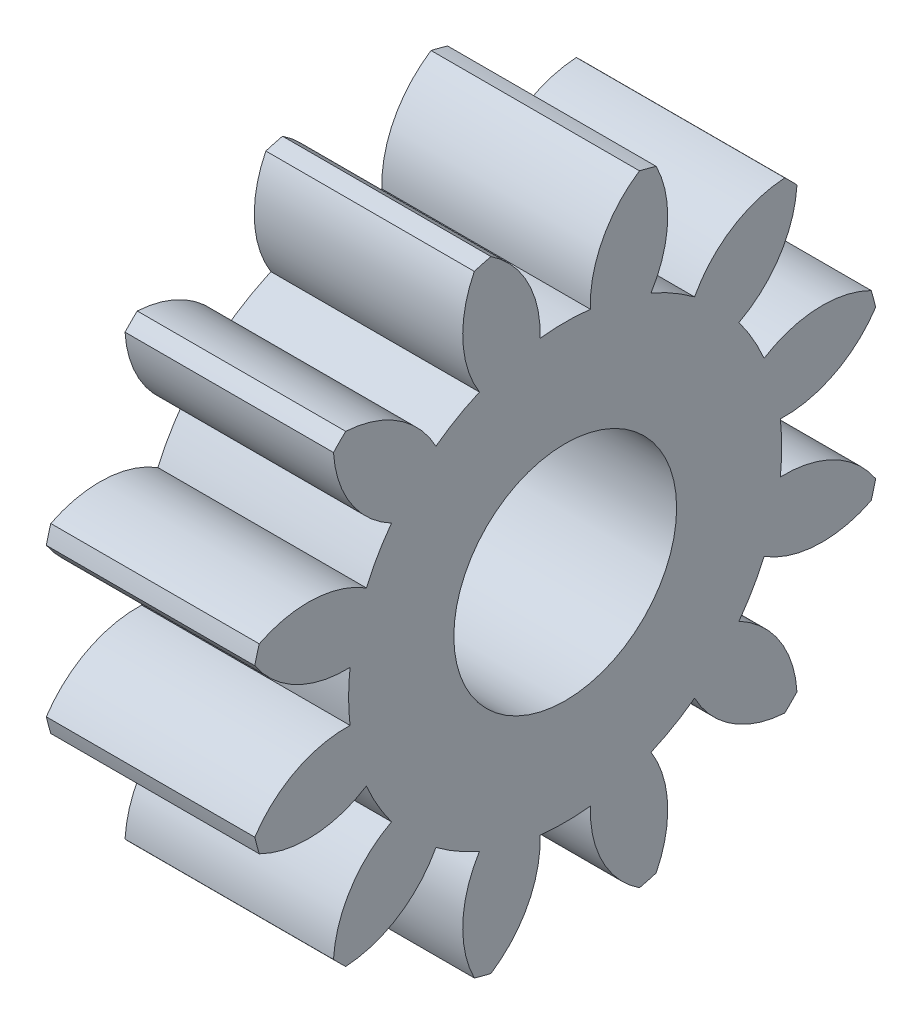
from build123d import *
from build123d.topology import SkipClean

# Parameters (mm, degrees)
BASPROSKE_W             = 8
BASPROSKE_H             = 12.25
TOOTHCUT_DEPTH          = 20.082059637
TEETHCUTS_COUNT         = 12
TEETHCUTS_ANGLE         = 330
HUBNEARONE_START        = 8.0000508
HUBNEAONESKE_R          = 8.3115
HUBNEARONE_DEPTH        = 8.0000508
BORSKE_R                = 4.5
BORE_DEPTH              = 16.0000508
ESQUISSE1_R             = 8.3115
ENL_V_MAT_EXTRU_1_DEPTH = 8
ESQUISSE2_R             = 4.5
ESQUISSE2_R_2           = 4.275
BOSS_EXTRU_1_DEPTH      = 8


with BuildPart() as part:
    # BasProSke → Base-Revolve (revolve)
    with BuildSketch(Plane(origin=(0, 0, 0), x_dir=(1, 0, 0), z_dir=(0, 1, 0))):
        with Locations((4, 6.125)):
            Rectangle(BASPROSKE_W, BASPROSKE_H)
    revolve(axis=Axis((-10, 0, 0), (1, 0, 0)))

    # TooCutSke → ToothCut (cut, through all)
    with BuildSketch(Plane(origin=(0, 0, 0), x_dir=(0, 0, -1), z_dir=(1, 0, 0))):
        with BuildLine():
            ThreePointArc((0.965128363, 8.255274647), (0, 8.3115), (-0.965128363, 8.255274647))
            ThreePointArc((-0.965128363, 8.255274647), (-1.43628674, 10.346733197), (-2.878284339, 11.933185846))
            ThreePointArc((-2.878284339, 11.933185846), (0, 12.2754), (2.878284339, 11.933185846))
            ThreePointArc((2.878284339, 11.933185846), (1.43628674, 10.346733197), (0.965128363, 8.255274647))
        make_face()
    toothcut = extrude(amount=TOOTHCUT_DEPTH, mode=Mode.SUBTRACT)

    # TeethCuts: ToothCut ×12 about axis
    teethcuts_axis = Axis((-10, 0, 0), (1, 0, 0))
    for i in range(1, TEETHCUTS_COUNT):
        add(toothcut.rotate(teethcuts_axis, i * TEETHCUTS_ANGLE / (TEETHCUTS_COUNT - 1)), mode=Mode.SUBTRACT)

    # HubNeaOneSke → HubNearOne (add)
    with SkipClean():  # the faces are left unmerged after this step: merging them gives an invalid solid
        with BuildSketch(Plane.ZY.offset(HUBNEARONE_START)):
            Circle(HUBNEAONESKE_R)
        extrude(amount=-HUBNEARONE_DEPTH)

    # BorSke → Bore (cut, symmetric)
    with SkipClean():  # the faces are left unmerged after this step: merging them gives an invalid solid
        with BuildSketch(Plane(origin=(0, 0, 0), x_dir=(0, 0, -1), z_dir=(1, 0, 0))):
            Circle(BORSKE_R)
        extrude(amount=BORE_DEPTH, both=True, mode=Mode.SUBTRACT)

    # Esquisse1 → Enlèv. mat.-Extru.1 (cut)
    with SkipClean():  # the faces are left unmerged after this step: merging them gives an invalid solid
        with BuildSketch(Plane.ZY.offset(8.0000508)):
            Circle(ESQUISSE1_R)
        extrude(amount=-ENL_V_MAT_EXTRU_1_DEPTH, mode=Mode.SUBTRACT)

    # Esquisse2 → Boss.-Extru.1 (add)
    with SkipClean():  # the faces are left unmerged after this step: merging them gives an invalid solid
        with BuildSketch(Plane(origin=(8, 0, 0), x_dir=(0, 0, -1), z_dir=(1, 0, 0))):
            Circle(ESQUISSE2_R)
            Circle(ESQUISSE2_R_2, mode=Mode.SUBTRACT)
        extrude(amount=-BOSS_EXTRU_1_DEPTH)


solid = part.part
